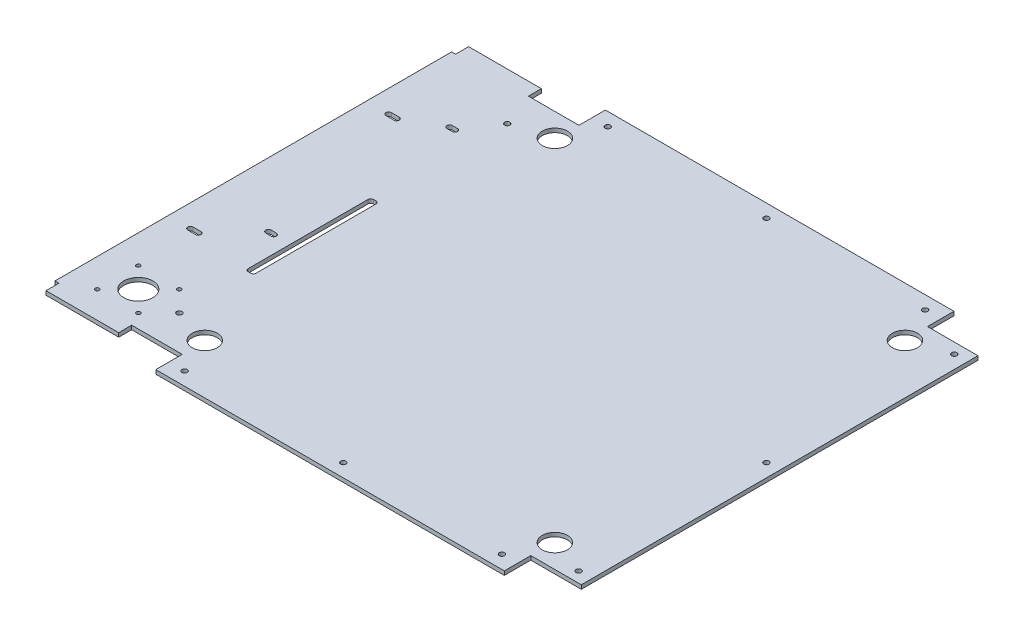
from build123d import *

# Parameters (mm, degrees)
SKETCH1_4_R         = 2
SKETCH1_4_R_2       = 9.5
SKETCH1_4_R_3       = 1.5
SKETCH1_4_R_4       = 11
BOSS_EXTRUDE3_DEPTH = 3


with BuildPart() as part:
    # Sketch1<4> → Boss-Extrude3 (new body)
    with BuildSketch(Plane(origin=(0, 0, 0), x_dir=(1, 0, 0), z_dir=(0, 1, 0))):
        Polygon((170, -150), (170, 150), (131.8, 150), (131.8, 170), (-131.8, 170), (-131.8, 150), (-170, 150), (-170, 159.8), (-225, 159.8), (-225, 150), (-228, 150), (-228, -150), (-225, -150), (-225, -159.8), (-170, -159.8), (-170, -150), (-131.8, -150), (-131.8, -170), (131.8, -170), (131.8, -150), align=None)
        with Locations((160, -142)):
            Circle(SKETCH1_4_R, mode=Mode.SUBTRACT)
        with Locations((160, 0)):
            Circle(SKETCH1_4_R, mode=Mode.SUBTRACT)
        with Locations((160, 142)):
            Circle(SKETCH1_4_R, mode=Mode.SUBTRACT)
        with Locations((132.375, -132.375)):
            Circle(SKETCH1_4_R_2, mode=Mode.SUBTRACT)
        with Locations((-160, -124)):
            Circle(SKETCH1_4_R, mode=Mode.SUBTRACT)
        with BuildLine():
            Line((-159, -70.911348687), (-161, -70.911348687))
            ThreePointArc((-161, -70.911348687), (-162.414213562, -70.325562249), (-163, -68.911348687))
            Line((-163, -68.911348687), (-163, 21.794447152))
            ThreePointArc((-163, 21.794447152), (-162.414213562, 23.208660714), (-161, 23.794447152))
            Line((-161, 23.794447152), (-159, 23.794447152))
            ThreePointArc((-159, 23.794447152), (-157.585786438, 23.208660714), (-157, 21.794447152))
            Line((-157, 21.794447152), (-157, -68.911348687))
            ThreePointArc((-157, -68.911348687), (-157.585786438, -70.325562249), (-159, -70.911348687))
        make_face(mode=Mode.SUBTRACT)
        with Locations((-160, 124)):
            Circle(SKETCH1_4_R, mode=Mode.SUBTRACT)
        with Locations((132.375, 132.375)):
            Circle(SKETCH1_4_R_2, mode=Mode.SUBTRACT)
        with Locations((0, -160)):
            Circle(SKETCH1_4_R, mode=Mode.SUBTRACT)
        with Locations((120, -160)):
            Circle(SKETCH1_4_R, mode=Mode.SUBTRACT)
        with Locations((-120, -160)):
            Circle(SKETCH1_4_R, mode=Mode.SUBTRACT)
        with Locations((120, 160)):
            Circle(SKETCH1_4_R, mode=Mode.SUBTRACT)
        with Locations((0, 160)):
            Circle(SKETCH1_4_R, mode=Mode.SUBTRACT)
        with Locations((-120, 160)):
            Circle(SKETCH1_4_R, mode=Mode.SUBTRACT)
        with Locations((-132.375, 132.375)):
            Circle(SKETCH1_4_R_2, mode=Mode.SUBTRACT)
        with Locations((-132.375, -132.375)):
            Circle(SKETCH1_4_R_2, mode=Mode.SUBTRACT)
        with Locations((-206.5, -108.5)):
            Circle(SKETCH1_4_R_3, mode=Mode.SUBTRACT)
        with Locations((-175.5, -108.5)):
            Circle(SKETCH1_4_R_3, mode=Mode.SUBTRACT)
        with Locations((-206.5, -139.5)):
            Circle(SKETCH1_4_R_3, mode=Mode.SUBTRACT)
        with Locations((-175.5, -139.5)):
            Circle(SKETCH1_4_R_3, mode=Mode.SUBTRACT)
        with Locations((-191, -124)):
            Circle(SKETCH1_4_R_4, mode=Mode.SUBTRACT)
        with BuildLine():
            ThreePointArc((-211.1, -66.5), (-213.1, -64.5), (-211.1, -62.5))
            Line((-211.1, -62.5), (-205.1, -62.5))
            ThreePointArc((-205.1, -62.5), (-203.1, -64.5), (-205.1, -66.5))
            Line((-205.1, -66.5), (-211.1, -66.5))
        make_face(mode=Mode.SUBTRACT)
        with BuildLine():
            ThreePointArc((-179.6, -39), (-181.6, -37), (-179.6, -35))
            Line((-179.6, -35), (-175.6, -35))
            ThreePointArc((-175.6, -35), (-173.6, -37), (-175.6, -39))
            Line((-175.6, -39), (-179.6, -39))
        make_face(mode=Mode.SUBTRACT)
        with BuildLine():
            ThreePointArc((-211.1, 83.4), (-213.1, 85.4), (-211.1, 87.4))
            Line((-211.1, 87.4), (-205.1, 87.4))
            ThreePointArc((-205.1, 87.4), (-203.1, 85.4), (-205.1, 83.4))
            Line((-205.1, 83.4), (-211.1, 83.4))
        make_face(mode=Mode.SUBTRACT)
        with BuildLine():
            ThreePointArc((-179.6, 98), (-181.6, 100), (-179.6, 102))
            Line((-179.6, 102), (-175.6, 102))
            ThreePointArc((-175.6, 102), (-173.6, 100), (-175.6, 98))
            Line((-175.6, 98), (-179.6, 98))
        make_face(mode=Mode.SUBTRACT)
    extrude(amount=BOSS_EXTRUDE3_DEPTH)


solid = part.part
